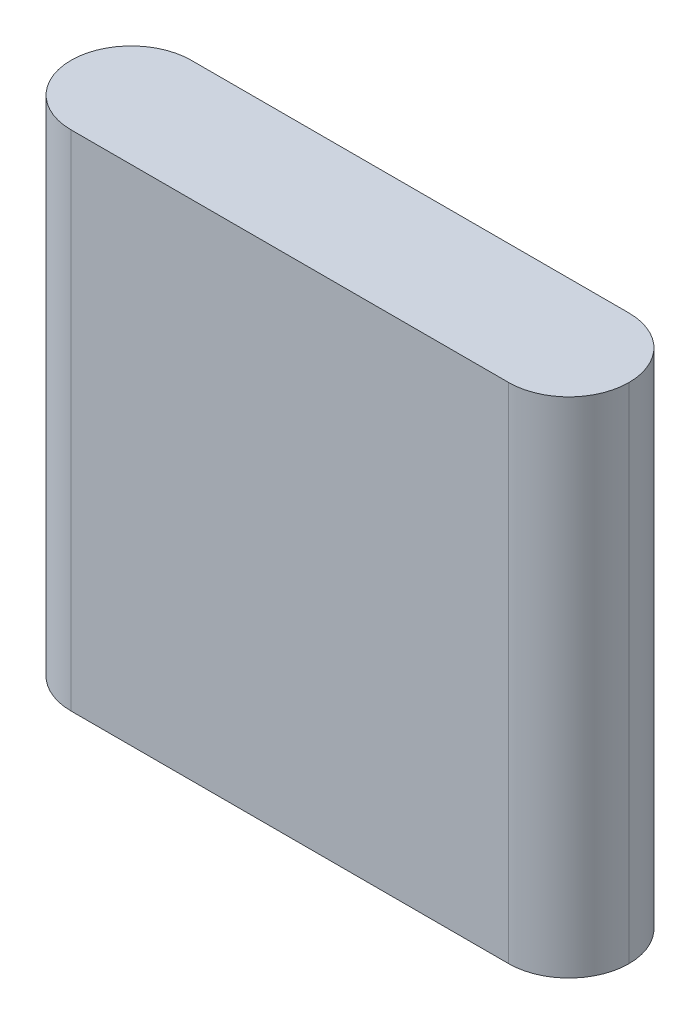
from build123d import *

# Parameters (mm, degrees)
SKETCH1_W           = 51
SKETCH1_H           = 46
BOSS_EXTRUDE1_DEPTH = 11
FILLET2_R           = 5.5
FILLET3_R           = 5.5


with BuildPart() as part:
    # Sketch1 → Boss-Extrude1 (new body)
    with BuildSketch(Plane.XY):
        Rectangle(SKETCH1_W, SKETCH1_H)
    extrude(amount=BOSS_EXTRUDE1_DEPTH)

    # Fillet2
    fillet2_edges = [part.edges().sort_by_distance(p)[0] for p in [
        (25.5, 0, 11),
    ]]
    fillet(fillet2_edges, radius=FILLET2_R)

    # Fillet3
    fillet3_edges = [part.edges().sort_by_distance(p)[0] for p in [
        (-25.5, 0, 11),
        (-25.5, 0, 0),
        (25.5, 0, 0),
    ]]
    fillet(fillet3_edges, radius=FILLET3_R - 0.0001)  # a hair under: the kernel refuses the full size


solid = part.part
